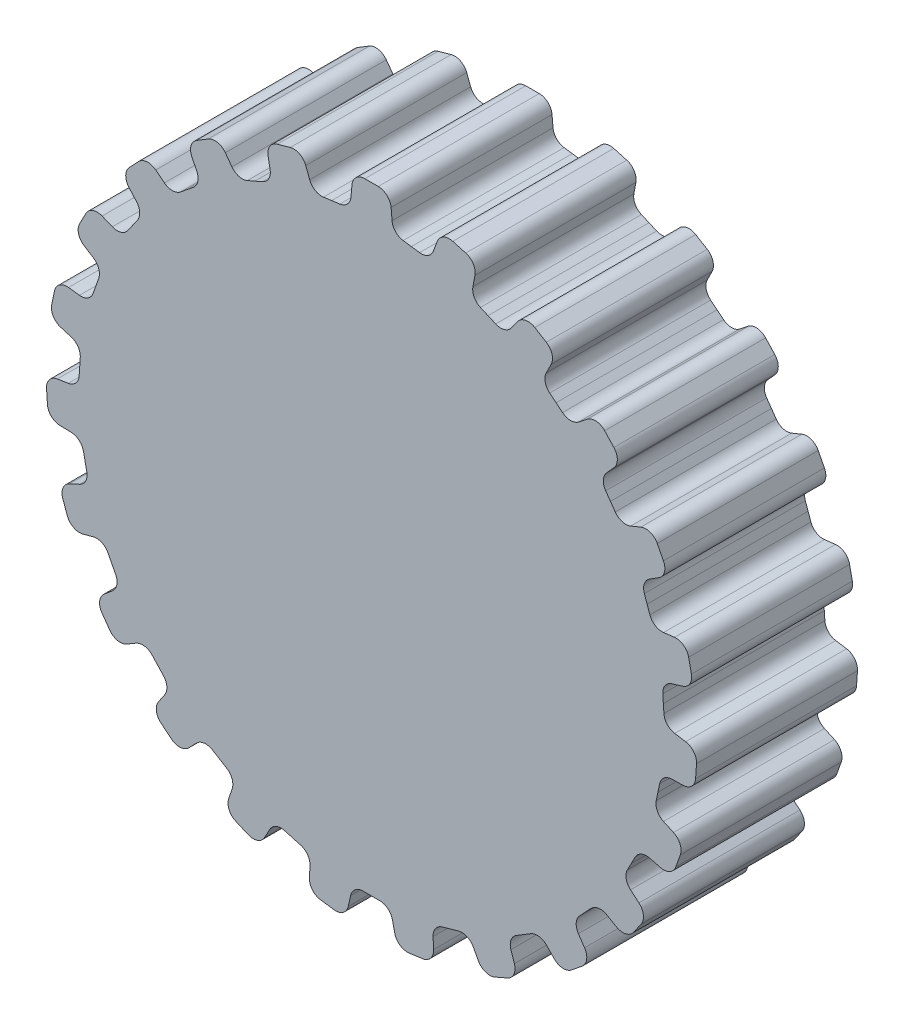
from build123d import *

# Parameters (mm, degrees)
EXTRUDE1_DEPTH = 5


with BuildPart() as part:
    # Sketch1 → Extrude1 (new body)
    with BuildSketch(Plane.XY):
        with BuildLine():
            Line((0.20946753, 10.105), (-0.20946753, 10.105))
            ThreePointArc((-0.20946753, 10.105), (-0.479703613, 9.999910935), (-0.60794541, 9.739862297))
            Line((-0.60794541, 9.739862297), (-0.637799577, 9.398627597))
            ThreePointArc((-0.637799577, 9.398627597), (-0.746562, 9.157691137), (-0.981857001, 9.037209168))
            Line((-0.981857001, 9.037209168), (-1.236264364, 9.002271903))
            Line((-1.236264364, 9.002271903), (-1.238363598, 9.00198362))
            Line((-1.238363598, 9.00198362), (-1.492762807, 8.966987031))
            ThreePointArc((-1.492762807, 8.966987031), (-1.751838077, 9.01951937), (-1.921571173, 9.222177502))
            Line((-1.921571173, 9.222177502), (-2.042382287, 9.542703736))
            ThreePointArc((-2.042382287, 9.542703736), (-2.236028813, 9.758509842), (-2.524596499, 9.786793097))
            Line((-2.524596499, 9.786793097), (-2.927996312, 9.67376577))
            ThreePointArc((-2.927996312, 9.67376577), (-3.159858617, 9.49966487), (-3.213184577, 9.214660319))
            Line((-3.213184577, 9.214660319), (-3.149867651, 8.878024969))
            ThreePointArc((-3.149867651, 8.878024969), (-3.189592989, 8.616679336), (-3.383656967, 8.437183334))
            Line((-3.383656967, 8.437183334), (-3.619204253, 8.334903352))
            Line((-3.619204253, 8.334903352), (-3.621147864, 8.334059393))
            Line((-3.621147864, 8.334059393), (-3.856671293, 8.231724487))
            ThreePointArc((-3.856671293, 8.231724487), (-4.120312405, 8.212411114), (-4.338427847, 8.361760691))
            Line((-4.338427847, 8.361760691), (-4.541235901, 8.637806493))
            ThreePointArc((-4.541235901, 8.637806493), (-4.785925278, 8.793364716), (-5.071422823, 8.742744522))
            Line((-5.071422823, 8.742744522), (-5.429369068, 8.525072588))
            ThreePointArc((-5.429369068, 8.525072588), (-5.60566143, 8.29487212), (-5.580116611, 8.006049139))
            Line((-5.580116611, 8.006049139), (-5.428324518, 7.698979843))
            ThreePointArc((-5.428324518, 7.698979843), (-5.396066525, 7.436607847), (-5.534506642, 7.211410209))
            Line((-5.534506642, 7.211410209), (-5.733724387, 7.049373149))
            Line((-5.733724387, 7.049373149), (-5.735368226, 7.048036106))
            Line((-5.735368226, 7.048036106), (-5.934548181, 6.885952596))
            ThreePointArc((-5.934548181, 6.885952596), (-6.183202079, 6.796225894), (-6.433523243, 6.881190342))
            Line((-6.433523243, 6.881190342), (-6.70328689, 7.092282659))
            ThreePointArc((-6.70328689, 7.092282659), (-6.980871627, 7.176055957), (-7.242124984, 7.050286581))
            Line((-7.242124984, 7.050286581), (-7.528070426, 6.744113772))
            ThreePointArc((-7.528070426, 6.744113772), (-7.635718046, 6.474886651), (-7.53319699, 6.20366592))
            Line((-7.53319699, 6.20366592), (-7.304187455, 5.948936603))
            ThreePointArc((-7.304187455, 5.948936603), (-7.202338559, 5.704997175), (-7.274887345, 5.450799779))
            Line((-7.274887345, 5.450799779), (-7.423000481, 5.241023189))
            Line((-7.423000481, 5.241023189), (-7.424222631, 5.239292225))
            Line((-7.424222631, 5.239292225), (-7.572286845, 5.029481102))
            ThreePointArc((-7.572286845, 5.029481102), (-7.787512008, 4.87599569), (-8.051473718, 4.890273584))
            Line((-8.051473718, 4.890273584), (-8.368185822, 5.020756665))
            ThreePointArc((-8.368185822, 5.020756665), (-8.658078731, 5.026531956), (-8.875711932, 4.834941137))
            Line((-8.875711932, 4.834941137), (-9.068449307, 4.462974889))
            ThreePointArc((-9.068449307, 4.462974889), (-9.099468453, 4.174688461), (-8.927574678, 3.941185179))
            Line((-8.927574678, 3.941185179), (-8.638332291, 3.75768795))
            ThreePointArc((-8.638332291, 3.75768795), (-8.474446158, 3.550272961), (-8.475723002, 3.285928466))
            Line((-8.475723002, 3.285928466), (-8.561746654, 3.043970515))
            Line((-8.561746654, 3.043970515), (-8.562456475, 3.041974007))
            Line((-8.562456475, 3.041974007), (-8.648423703, 2.799996003))
            ThreePointArc((-8.648423703, 2.799996003), (-8.814257864, 2.594135193), (-9.072283287, 2.536667607))
            Line((-9.072283287, 2.536667607), (-9.412454762, 2.576864118))
            ThreePointArc((-9.412454762, 2.576864118), (-9.69315581, 2.504213075), (-9.851027997, 2.261010228))
            Line((-9.851027997, 2.261010228), (-9.936262854, 1.850837576))
            ThreePointArc((-9.936262854, 1.850837576), (-9.888352979, 1.564872725), (-9.65983506, 1.386404764))
            Line((-9.65983506, 1.386404764), (-9.331811606, 1.287748772))
            ThreePointArc((-9.331811606, 1.287748772), (-9.118042921, 1.132241243), (-9.047953124, 0.877354871))
            Line((-9.047953124, 0.877354871), (-9.065507312, 0.621160473))
            Line((-9.065507312, 0.621160473), (-9.06565216, 0.619046494))
            Line((-9.06565216, 0.619046494), (-9.083146605, 0.36284801))
            ThreePointArc((-9.083146605, 0.36284801), (-9.187290605, 0.119879556), (-9.420243176, -0.005071402))
            Line((-9.420243176, -0.005071402), (-9.758645058, -0.058142652))
            ThreePointArc((-9.758645058, -0.058142652), (-10.009335933, -0.203831834), (-10.095738449, -0.480609466))
            Line((-10.095738449, -0.480609466), (-10.067149309, -0.898567892))
            ThreePointArc((-10.067149309, -0.898567892), (-9.943863668, -1.161002461), (-9.675669734, -1.271198949))
            Line((-9.675669734, -1.271198949), (-9.333193211, -1.277696841))
            ThreePointArc((-9.333193211, -1.277696841), (-9.085396219, -1.369763628), (-8.949138023, -1.596288121))
            Line((-8.949138023, -1.596288121), (-8.896920832, -1.847718199))
            Line((-8.896920832, -1.847718199), (-8.896489964, -1.849792865))
            Line((-8.896489964, -1.849792865), (-8.844214144, -2.10121076))
            ThreePointArc((-8.844214144, -2.10121076), (-8.878944097, -2.363266999), (-9.06954679, -2.546434288))
            Line((-9.06954679, -2.546434288), (-9.381081361, -2.688837248))
            ThreePointArc((-9.381081361, -2.688837248), (-9.583169467, -2.896759468), (-9.591694232, -3.186584554))
            Line((-9.591694232, -3.186584554), (-9.451401421, -3.581330691))
            ThreePointArc((-9.451401421, -3.581330691), (-9.261883547, -3.800771406), (-8.973904315, -3.834523652))
            Line((-8.973904315, -3.834523652), (-8.64237464, -3.748381524))
            ThreePointArc((-8.64237464, -3.748381524), (-8.378927311, -3.770179397), (-8.186606361, -3.951541726))
            Line((-8.186606361, -3.951541726), (-8.068490502, -4.179560065))
            Line((-8.068490502, -4.179560065), (-8.067515874, -4.18144155))
            Line((-8.067515874, -4.18144155), (-7.949346847, -4.40943234))
            ThreePointArc((-7.949346847, -4.40943234), (-7.912086992, -4.671140852), (-8.046203676, -4.898939792))
            Line((-8.046203676, -4.898939792), (-8.307765842, -5.120113085))
            ThreePointArc((-8.307765842, -5.120113085), (-8.446263229, -5.374847704), (-8.376278, -5.656225244))
            Line((-8.376278, -5.656225244), (-8.134686394, -5.998482575))
            ThreePointArc((-8.134686394, -5.998482575), (-7.89299196, -6.158654523), (-7.606585532, -6.113459278))
            Line((-7.606585532, -6.113459278), (-7.310590745, -5.941065897))
            ThreePointArc((-7.310590745, -5.941065897), (-7.051031762, -5.890978207), (-6.816911624, -6.013727558))
            Line((-6.816911624, -6.013727558), (-6.64165721, -6.201423081))
            Line((-6.64165721, -6.201423081), (-6.640211104, -6.202971844))
            Line((-6.640211104, -6.202971844), (-6.464912927, -6.390626494))
            ThreePointArc((-6.464912927, -6.390626494), (-6.358426657, -6.632577557), (-6.426110512, -6.888113343))
            Line((-6.426110512, -6.888113343), (-6.618301403, -7.171653557))
            ThreePointArc((-6.618301403, -7.171653557), (-6.682936354, -7.454308073), (-6.539631615, -7.706369582))
            Line((-6.539631615, -7.706369582), (-6.214658958, -7.970754448))
            ThreePointArc((-6.214658958, -7.970754448), (-5.938713335, -8.059778408), (-5.675121166, -7.938987595))
            Line((-5.675121166, -7.938987595), (-5.436613846, -7.693128591))
            ThreePointArc((-5.436613846, -7.693128591), (-5.200193511, -7.574870113), (-4.941637804, -7.629902727))
            Line((-4.941637804, -7.629902727), (-4.722242653, -7.763354916))
            Line((-4.722242653, -7.763354916), (-4.720432322, -7.764456092))
            Line((-4.720432322, -7.764456092), (-4.501006058, -7.897857117))
            ThreePointArc((-4.501006058, -7.897857117), (-4.333190972, -8.102106326), (-4.329422197, -8.366427037))
            Line((-4.329422197, -8.366427037), (-4.437987893, -8.691305293))
            ThreePointArc((-4.437987893, -8.691305293), (-4.423966729, -8.980916514), (-4.217970737, -9.184967743))
            Line((-4.217970737, -9.184967743), (-3.833718765, -9.351871927))
            ThreePointArc((-3.833718765, -9.351871927), (-3.543987577, -9.363145399), (-3.322759092, -9.175717521))
            Line((-3.322759092, -9.175717521), (-3.159428235, -8.874627131))
            ThreePointArc((-3.159428235, -8.874627131), (-2.963680764, -8.696968555), (-2.699865382, -8.680202916))
            Line((-2.699865382, -8.680202916), (-2.452601029, -8.749514232))
            Line((-2.452601029, -8.749514232), (-2.450560736, -8.750086152))
            Line((-2.450560736, -8.750086152), (-2.203280227, -8.819339807))
            ThreePointArc((-2.203280227, -8.819339807), (-1.986582403, -8.970738933), (-1.911640509, -9.224241112))
            Line((-1.911640509, -9.224241112), (-1.92852919, -9.566362676))
            ThreePointArc((-1.92852919, -9.566362676), (-1.836891797, -9.841451462), (-1.583482333, -9.982358864))
            Line((-1.583482333, -9.982358864), (-1.168449256, -10.039403847))
            ThreePointArc((-1.168449256, -10.039403847), (-0.886420541, -9.972090729), (-0.723963244, -9.731926454))
            Line((-0.723963244, -9.731926454), (-0.647922354, -9.397935175))
            ThreePointArc((-0.647922354, -9.397935175), (-0.50736544, -9.174052625), (-0.257856363, -9.086732163))
            Line((-0.257856363, -9.086732163), (-0.001061274, -9.086762104))
            Line((-0.001061274, -9.086762104), (0.001057662, -9.086762351))
            Line((0.001057662, -9.086762351), (0.257852751, -9.08673241))
            ThreePointArc((0.257852751, -9.08673241), (0.507361828, -9.174052872), (0.647918742, -9.397935422))
            Line((0.647918742, -9.397935422), (0.723959632, -9.731926701))
            ThreePointArc((0.723959632, -9.731926701), (0.886416929, -9.972090976), (1.168445644, -10.039404094))
            Line((1.168445644, -10.039404094), (1.583478721, -9.982359111))
            ThreePointArc((1.583478721, -9.982359111), (1.836888185, -9.841451709), (1.928525579, -9.566362923))
            Line((1.928525579, -9.566362923), (1.911636898, -9.224241359))
            ThreePointArc((1.911636898, -9.224241359), (1.986578791, -8.97073918), (2.203276615, -8.819340055))
            Line((2.203276615, -8.819340055), (2.450557124, -8.750086399))
            Line((2.450557124, -8.750086399), (2.452597551, -8.749514955))
            Line((2.452597551, -8.749514955), (2.699861904, -8.680203638))
            ThreePointArc((2.699861904, -8.680203638), (2.963677285, -8.696969278), (3.159424757, -8.874627854))
            Line((3.159424757, -8.874627854), (3.322755613, -9.175718244))
            ThreePointArc((3.322755613, -9.175718244), (3.543984099, -9.363146122), (3.833715286, -9.35187265))
            Line((3.833715286, -9.35187265), (4.217967259, -9.184968465))
            ThreePointArc((4.217967259, -9.184968465), (4.42396325, -8.980917237), (4.437984414, -8.691306016))
            Line((4.437984414, -8.691306016), (4.329418718, -8.36642776))
            ThreePointArc((4.329418718, -8.36642776), (4.333187493, -8.102107049), (4.501002579, -7.89785784))
            Line((4.501002579, -7.89785784), (4.720428843, -7.764456815))
            Line((4.720428843, -7.764456815), (4.722239432, -7.763356061))
            Line((4.722239432, -7.763356061), (4.941634582, -7.629903872))
            ThreePointArc((4.941634582, -7.629903872), (5.200190289, -7.574871258), (5.436610624, -7.693129736))
            Line((5.436610624, -7.693129736), (5.675117944, -7.93898874))
            ThreePointArc((5.675117944, -7.93898874), (5.938710113, -8.059779553), (6.214655736, -7.970755593))
            Line((6.214655736, -7.970755593), (6.539628393, -7.706370727))
            ThreePointArc((6.539628393, -7.706370727), (6.682933132, -7.454309218), (6.618298181, -7.171654702))
            Line((6.618298181, -7.171654702), (6.426107291, -6.888114488))
            ThreePointArc((6.426107291, -6.888114488), (6.358423435, -6.632578702), (6.464909705, -6.390627639))
            Line((6.464909705, -6.390627639), (6.640207883, -6.202972989))
            Line((6.640207883, -6.202972989), (6.641654349, -6.201424563))
            Line((6.641654349, -6.201424563), (6.816908763, -6.01372904))
            ThreePointArc((6.816908763, -6.01372904), (7.051028901, -5.890979689), (7.310587884, -5.94106738))
            Line((7.310587884, -5.94106738), (7.606582672, -6.11346076))
            ThreePointArc((7.606582672, -6.11346076), (7.8929891, -6.158656005), (8.134683533, -5.998484058))
            Line((8.134683533, -5.998484058), (8.376275139, -5.656226726))
            ThreePointArc((8.376275139, -5.656226726), (8.446260368, -5.374849186), (8.307762981, -5.120114567))
            Line((8.307762981, -5.120114567), (8.046200816, -4.898941274))
            ThreePointArc((8.046200816, -4.898941274), (7.912084131, -4.671142334), (7.949343986, -4.409433822))
            Line((7.949343986, -4.409433822), (8.067513013, -4.181443032))
            Line((8.067513013, -4.181443032), (8.06848808, -4.179561774))
            Line((8.06848808, -4.179561774), (8.186603939, -3.951543435))
            ThreePointArc((8.186603939, -3.951543435), (8.378924889, -3.770181106), (8.642372218, -3.748383234))
            Line((8.642372218, -3.748383234), (8.973901893, -3.834525362))
            ThreePointArc((8.973901893, -3.834525362), (9.261881125, -3.800773116), (9.451398999, -3.5813324))
            Line((9.451398999, -3.5813324), (9.59169181, -3.186586264))
            ThreePointArc((9.59169181, -3.186586264), (9.583167045, -2.896761177), (9.381078939, -2.688838957))
            Line((9.381078939, -2.688838957), (9.069544368, -2.546435998))
            ThreePointArc((9.069544368, -2.546435998), (8.878941675, -2.363268709), (8.844211722, -2.101212469))
            Line((8.844211722, -2.101212469), (8.896487542, -1.849794575))
            Line((8.896487542, -1.849794575), (8.896918894, -1.847720009))
            Line((8.896918894, -1.847720009), (8.949136084, -1.596289931))
            ThreePointArc((8.949136084, -1.596289931), (9.085394281, -1.369765438), (9.333191273, -1.277698651))
            Line((9.333191273, -1.277698651), (9.675667796, -1.27120076))
            ThreePointArc((9.675667796, -1.27120076), (9.94386173, -1.161004271), (10.067147371, -0.898569702))
            Line((10.067147371, -0.898569702), (10.095736511, -0.480611276))
            ThreePointArc((10.095736511, -0.480611276), (10.009333995, -0.203833644), (9.75864312, -0.058144463))
            Line((9.75864312, -0.058144463), (9.420241238, -0.005073212))
            ThreePointArc((9.420241238, -0.005073212), (9.187288667, 0.119877746), (9.083144667, 0.3628462))
            Line((9.083144667, 0.3628462), (9.065650222, 0.619044684))
            Line((9.065650222, 0.619044684), (9.065505867, 0.621158697))
            Line((9.065505867, 0.621158697), (9.047951679, 0.877353095))
            ThreePointArc((9.047951679, 0.877353095), (9.118041475, 1.132239467), (9.33181016, 1.287746996))
            Line((9.33181016, 1.287746996), (9.659833615, 1.386402988))
            ThreePointArc((9.659833615, 1.386402988), (9.888351534, 1.564870949), (9.936261409, 1.8508358))
            Line((9.936261409, 1.8508358), (9.851026552, 2.261008452))
            ThreePointArc((9.851026552, 2.261008452), (9.693154364, 2.504211298), (9.412453317, 2.576862341))
            Line((9.412453317, 2.576862341), (9.072281842, 2.536665831))
            ThreePointArc((9.072281842, 2.536665831), (8.814256419, 2.594133417), (8.648422257, 2.799994226))
            Line((8.648422257, 2.799994226), (8.56245503, 3.041972231))
            Line((8.56245503, 3.041972231), (8.561745674, 3.043968904))
            Line((8.561745674, 3.043968904), (8.475722022, 3.285926855))
            ThreePointArc((8.475722022, 3.285926855), (8.474445178, 3.55027135), (8.638331311, 3.757686339))
            Line((8.638331311, 3.757686339), (8.927573698, 3.941183568))
            ThreePointArc((8.927573698, 3.941183568), (9.099467473, 4.17468685), (9.068448327, 4.462973278))
            Line((9.068448327, 4.462973278), (8.875710952, 4.834939526))
            ThreePointArc((8.875710952, 4.834939526), (8.658077751, 5.026530345), (8.368184843, 5.020755054))
            Line((8.368184843, 5.020755054), (8.051472738, 4.890271973))
            ThreePointArc((8.051472738, 4.890271973), (7.787511029, 4.875994079), (7.572285866, 5.029479491))
            Line((7.572285866, 5.029479491), (7.424221651, 5.239290614))
            Line((7.424221651, 5.239290614), (7.422999905, 5.241021863))
            Line((7.422999905, 5.241021863), (7.274886769, 5.450798453))
            ThreePointArc((7.274886769, 5.450798453), (7.202337983, 5.704995849), (7.304186879, 5.948935277))
            Line((7.304186879, 5.948935277), (7.533196414, 6.203664594))
            ThreePointArc((7.533196414, 6.203664594), (7.63571747, 6.474885325), (7.52806985, 6.744112446))
            Line((7.52806985, 6.744112446), (7.242124408, 7.050285255))
            ThreePointArc((7.242124408, 7.050285255), (6.980871051, 7.176054631), (6.703286314, 7.092281333))
            Line((6.703286314, 7.092281333), (6.433522667, 6.881189016))
            ThreePointArc((6.433522667, 6.881189016), (6.183201503, 6.796224568), (5.934547605, 6.88595127))
            Line((5.934547605, 6.88595127), (5.73536765, 7.04803478))
            Line((5.73536765, 7.04803478), (5.733724123, 7.049372207))
            Line((5.733724123, 7.049372207), (5.534506377, 7.211409266))
            ThreePointArc((5.534506377, 7.211409266), (5.396066261, 7.436606905), (5.428324254, 7.6989789))
            Line((5.428324254, 7.6989789), (5.580116346, 8.006048196))
            ThreePointArc((5.580116346, 8.006048196), (5.605661166, 8.294871177), (5.429368804, 8.525071645))
            Line((5.429368804, 8.525071645), (5.071422559, 8.742743579))
            ThreePointArc((5.071422559, 8.742743579), (4.785925014, 8.793363774), (4.541235637, 8.637805551))
            Line((4.541235637, 8.637805551), (4.338427583, 8.361759748))
            ThreePointArc((4.338427583, 8.361759748), (4.120312141, 8.212410171), (3.856671029, 8.231723544))
            Line((3.856671029, 8.231723544), (3.621147599, 8.33405845))
            Line((3.621147599, 8.33405845), (3.619204186, 8.334902863))
            Line((3.619204186, 8.334902863), (3.383656899, 8.437182844))
            ThreePointArc((3.383656899, 8.437182844), (3.189592922, 8.616678847), (3.149867584, 8.878024479))
            Line((3.149867584, 8.878024479), (3.21318451, 9.214659829))
            ThreePointArc((3.21318451, 9.214659829), (3.15985855, 9.49966438), (2.927996244, 9.673765281))
            Line((2.927996244, 9.673765281), (2.524596432, 9.786792607))
            ThreePointArc((2.524596432, 9.786792607), (2.236028745, 9.758509352), (2.04238222, 9.542703246))
            Line((2.04238222, 9.542703246), (1.921571106, 9.222177013))
            ThreePointArc((1.921571106, 9.222177013), (1.75183801, 9.019518881), (1.49276274, 8.966986541))
            Line((1.49276274, 8.966986541), (1.23836353, 9.00198313))
            Line((1.23836353, 9.00198313), (1.236264364, 9.002271903))
            Line((1.236264364, 9.002271903), (0.981857001, 9.037209168))
            ThreePointArc((0.981857001, 9.037209168), (0.746562, 9.157691137), (0.637799577, 9.398627597))
            Line((0.637799577, 9.398627597), (0.60794541, 9.739862297))
            ThreePointArc((0.60794541, 9.739862297), (0.479703613, 9.999910935), (0.20946753, 10.105))
        make_face()
    extrude(amount=EXTRUDE1_DEPTH)


solid = part.part
